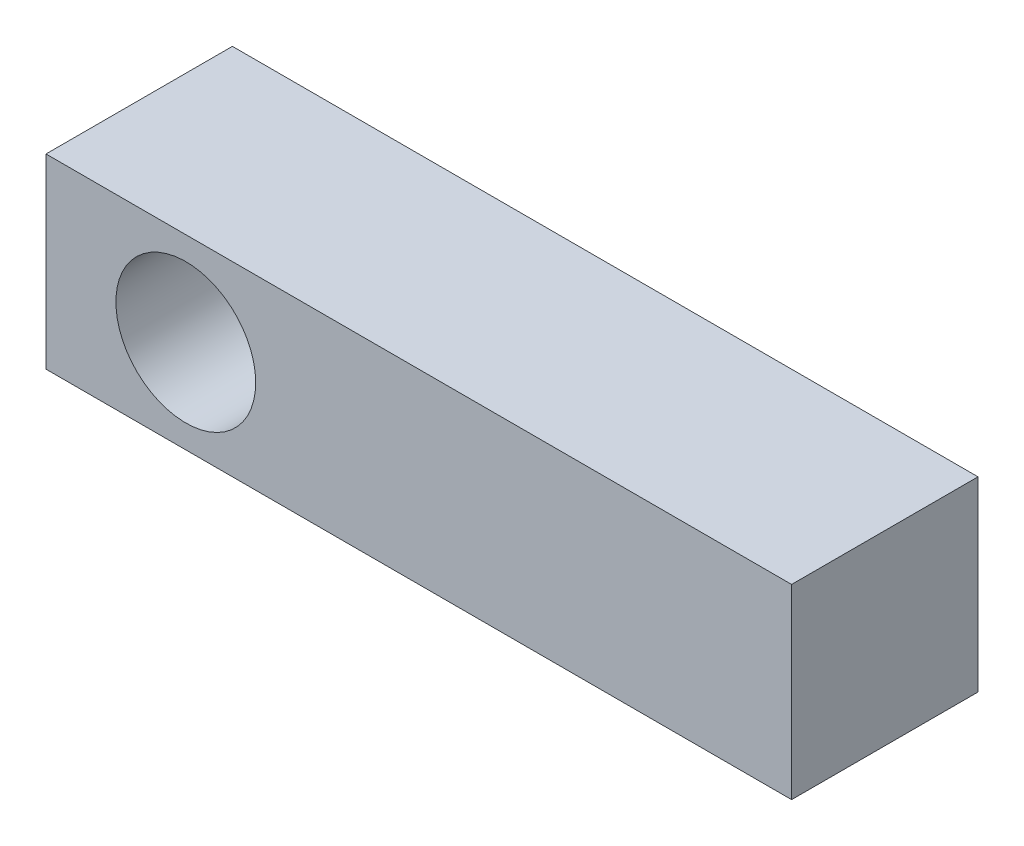
from build123d import *

# Parameters (mm, degrees)
SKETCH1_W               = 20
SKETCH1_H               = 20
BOSS_EXTRUDE1_DEPTH     = 40
CUT_EXTRUDE1_DEPTH      = 43.426406871
CUT_EXTRUDE1_DEPTH_BACK = 43.426406871
SKETCH4_R               = 7.5


with BuildPart() as part:
    # Sketch1 → Boss-Extrude1 (new, symmetric)
    with BuildSketch(Plane(origin=(0, 0, 0), x_dir=(0, 0, -1), z_dir=(1, 0, 0))):
        Rectangle(SKETCH1_W, SKETCH1_H)
    extrude(amount=BOSS_EXTRUDE1_DEPTH, both=True)

    # Sketch4 → Cut-Extrude1 (cut, two sides: drawn at the far end of the back side and taken through both)
    with BuildSketch(Plane.XY.offset(-CUT_EXTRUDE1_DEPTH_BACK)):
        with Locations((-25, 0)):
            Circle(SKETCH4_R)
    extrude(amount=CUT_EXTRUDE1_DEPTH + CUT_EXTRUDE1_DEPTH_BACK, mode=Mode.SUBTRACT)


solid = part.part
